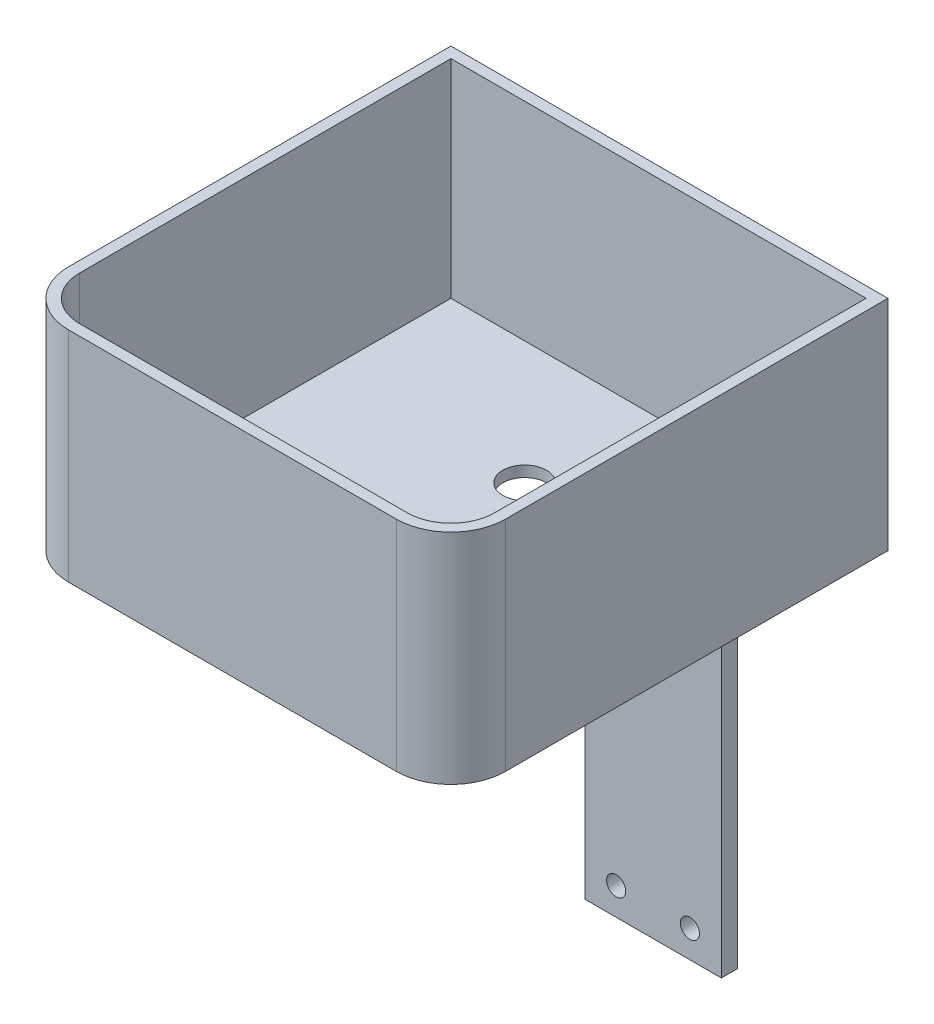
from build123d import *

# Parameters (mm, degrees)
SKETCH1_W           = 25
SKETCH1_H           = 60
BOSS_EXTRUDE1_DEPTH = 3
BOSS_EXTRUDE3_START = -3
SKETCH2_W           = 80
SKETCH2_H           = 40
BOSS_EXTRUDE3_DEPTH = 80
FILLET1_R           = 10
SHELL1_START        = 52
SHELL1_DEPTH        = 38
SKETCH3_R           = 4
CUT_EXTRUDE1_DEPTH  = 100
SKETCH4_R           = 1.75
CUT_EXTRUDE2_DEPTH  = 100
CHAMFER1_SIZE       = 20
FILLET2_R           = 15


with BuildPart() as part:
    # Sketch1 → Boss-Extrude1 (new body)
    with BuildSketch(Plane.XY):
        Rectangle(SKETCH1_W, SKETCH1_H)
        Polygon((12.5, 50), (12.5, 30), (-12.5, 30), (-12.5, 50), (-40, 50), (-40, 90), (40, 90), (40, 50), align=None)
    extrude(amount=BOSS_EXTRUDE1_DEPTH)

    # Sketch2 → Boss-Extrude3 (add)
    with BuildSketch(Plane.XY.offset(3).offset(BOSS_EXTRUDE3_START)):
        with Locations((0, 70)):
            Rectangle(SKETCH2_W, SKETCH2_H)
    extrude(amount=BOSS_EXTRUDE3_DEPTH)

    # Fillet1
    fillet1_edges = [part.edges().sort_by_distance(p)[0] for p in [
        (-40, 70, 80),
        (40, 70, 80),
    ]]
    fillet(fillet1_edges, radius=FILLET1_R)

    # Shell1: read off the stored shape, not the designer's step
    # Shell1 outline → Shell1 (cut)
    with BuildSketch(Plane(origin=(0, 0, 0), x_dir=(1, 0, 0), z_dir=(0, 1, 0)).offset(SHELL1_START)):
        with BuildLine():
            ThreePointArc((30, -78), (35.656854249, -75.656854249), (38, -70))
            Line((38, -70), (38, -2))
            Line((38, -2), (-38, -2))
            Line((-38, -2), (-38, -70))
            ThreePointArc((-38, -70), (-35.656854249, -75.656854249), (-30, -78))
            Line((-30, -78), (30, -78))
        make_face()
    extrude(amount=SHELL1_DEPTH, mode=Mode.SUBTRACT)

    # Sketch3 → Cut-Extrude1 (cut)
    with BuildSketch(Plane(origin=(0, 52, 0), x_dir=(1, 0, 0), z_dir=(0, 1, 0))):
        with Locations(Location((-2, -24.5, 0), (0, 0, 270))):
            Circle(SKETCH3_R)
    extrude(amount=-CUT_EXTRUDE1_DEPTH, mode=Mode.SUBTRACT)

    # Sketch4 → Cut-Extrude2 (cut)
    with BuildSketch(Plane.XY.offset(3)):
        with Locations((-6.75, 25)):
            Circle(SKETCH4_R)
        with Locations((6.75, 25)):
            Circle(SKETCH4_R)
        with Locations((6.75, -25)):
            Circle(SKETCH4_R)
        with Locations((-6.75, -25)):
            Circle(SKETCH4_R)
    extrude(amount=-CUT_EXTRUDE2_DEPTH, mode=Mode.SUBTRACT)

    # Chamfer1
    chamfer1_edges = [part.edges().sort_by_distance(p)[0] for p in [
        (-12.5, 50, 1.5),
        (12.5, 50, 1.5),
    ]]
    chamfer(chamfer1_edges, length=CHAMFER1_SIZE)

    # Fillet2
    fillet2_edges = [part.edges().sort_by_distance(p)[0] for p in [
        (-32.5, 50, 1.5),
        (32.5, 50, 1.5),
        (12.5, 30, 1.5),
        (-12.5, 30, 1.5),
    ]]
    fillet(fillet2_edges, radius=FILLET2_R)


solid = part.part
